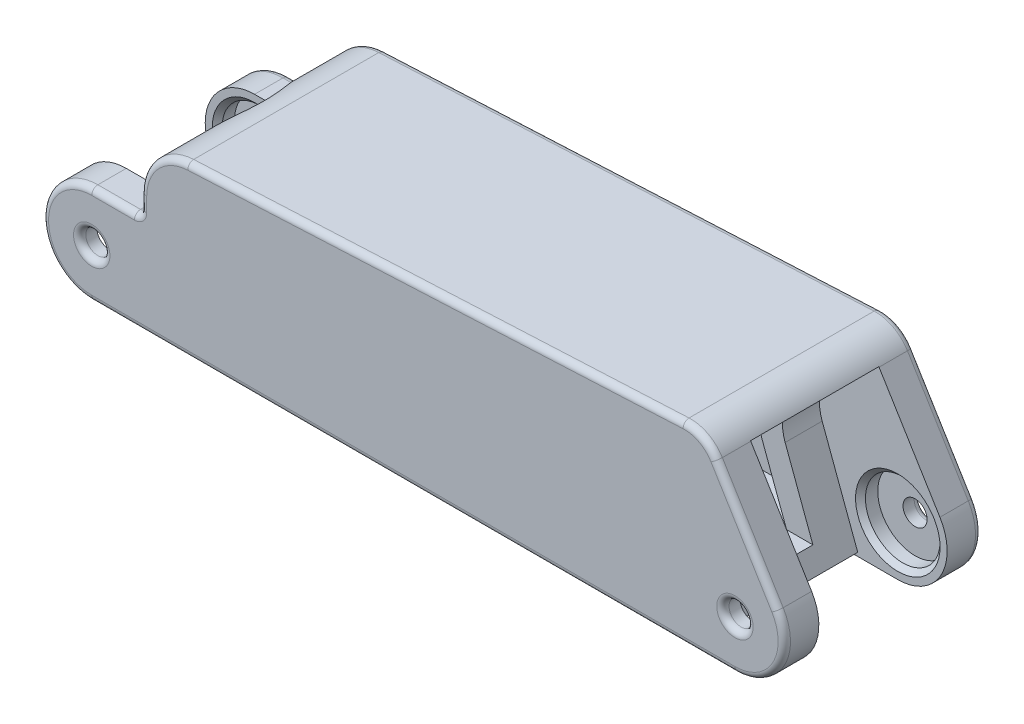
from build123d import *
from OCP.BRepFilletAPI import BRepFilletAPI_MakeChamfer

# Parameters (mm, degrees)
EXTRUDE_1_DEPTH          = 8
EXTRUDE_1_DEPTH_BACK     = 8
CUT_EXTRUDE_1_DEPTH      = 2.2
CUT_EXTRUDE_1_DEPTH_BACK = 2.2
CUT_EXTRUDE_2_DEPTH      = 58.87966418
CUT_EXTRUDE_2_DEPTH_BACK = 58.87966418
SKETCH_3_R               = 0.975
CUT_EXTRUDE_5_DEPTH      = 58.268661587
CUT_EXTRUDE_5_DEPTH_BACK = 58.268661587
CUT_EXTRUDE_6_DEPTH      = 5.2
CUT_EXTRUDE_6_DEPTH_BACK = 5.2
SKETCH_6_R               = 3.025
CUT_EXTRUDE_7_DEPTH      = 1.4
SKETCH_7_R               = 3.025
CUT_EXTRUDE_8_DEPTH      = 1.4
CUT_EXTRUDE_10_DEPTH     = 3.2
SKETCH_8_W               = 15
SKETCH_8_H               = 10.4
CUT_EXTRUDE_9_DEPTH      = 8.4
SKETCH_10_W              = 25
SKETCH_10_H              = 4.4
EXTRUDE_2_DEPTH          = 2
CUT_EXTRUDE_11_DEPTH     = 4.5
FILLET_2_R               = 0.5
CHAMFER_1_SIZE           = 0.4
CHAMFER_1_SIZE2          = 0.311176836
FILLET_3_R               = 1.5


with BuildPart() as part:
    # 草图1 → 凸台-拉伸1 (new, two sides: drawn at the far end of the back side and taken through both)
    with BuildSketch(Plane.XY.offset(-EXTRUDE_1_DEPTH_BACK)):
        with BuildLine():
            Line((0, -4), (52.14, -4))
            ThreePointArc((52.14, -4), (55.62877552, -1.95664135), (55.553141222, 2.085777314))
            Line((55.553141222, 2.085777314), (50.621697444, 10.155533337))
            ThreePointArc((50.621697444, 10.155533337), (49.466230751, 11.242179588), (47.918174328, 11.587758333))
            Line((47.918174328, 11.587758333), (7.766731223, 9.662734546))
            ThreePointArc((7.766731223, 9.662734546), (5.062926971, 8.427194819), (3.958287489, 5.667323904))
            Line((3.958287489, 5.667323904), (3.958287489, 4))
            Line((3.958287489, 4), (0, 4))
            ThreePointArc((0, 4), (-4, 0), (0, -4))
        make_face()
    extrude(amount=EXTRUDE_1_DEPTH + EXTRUDE_1_DEPTH_BACK)

    # 草图2 → 切除-拉伸1 (cut, two sides: drawn at the far end of the back side and taken through both)
    with BuildSketch(Plane.XY.offset(-CUT_EXTRUDE_1_DEPTH_BACK)):
        with BuildLine():
            Line((-1.528760289, -3.696334939), (0.036061068, -6.887575742))
            ThreePointArc((0.036061068, -6.887575742), (2.795380789, -8.566052308), (5.478529806, -6.768320332))
            ThreePointArc((5.478529806, -6.768320332), (6.228661924, -5.326880509), (7.166657167, -4))
            Line((7.166657167, -4), (52.14, -4))
            ThreePointArc((52.14, -4), (55.62877552, -1.95664135), (55.553141222, 2.085777314))
            Line((55.553141222, 2.085777314), (52.700312321, 6.754112641))
            ThreePointArc((52.700312321, 6.754112641), (51.683787236, 8.461058728), (49.823530783, 9.15850702))
            ThreePointArc((49.823530783, 9.15850702), (26.4662767, 8.111764825), (3.449969925, 4))
            Line((3.449969925, 4), (0, 4))
            ThreePointArc((0, 4), (-3.923349319, 0.779313879), (-1.528760289, -3.696334939))
        make_face()
    extrude(amount=CUT_EXTRUDE_1_DEPTH + CUT_EXTRUDE_1_DEPTH_BACK, mode=Mode.SUBTRACT)

    # 草图3 → 切除-拉伸2 (cut, two sides: drawn at the far end of the back side and taken through both)
    with BuildSketch(Plane.XY.offset(-CUT_EXTRUDE_2_DEPTH_BACK)):
        Circle(SKETCH_3_R)
        with Locations((52.14, 0)):
            Circle(SKETCH_3_R)
    extrude(amount=CUT_EXTRUDE_2_DEPTH + CUT_EXTRUDE_2_DEPTH_BACK, mode=Mode.SUBTRACT)

    # 草图4 → 切除-拉伸5 (cut, two sides: drawn at the far end of the back side and taken through both)
    with BuildSketch(Plane(origin=(0, 4, 0), x_dir=(1, 0, 0), z_dir=(0, 1, 0)).offset(-CUT_EXTRUDE_5_DEPTH_BACK)):
        with BuildLine():
            Line((-2.993325909, 5.2), (2.993325909, 5.2))
            ThreePointArc((2.993325909, 5.2), (6, 0), (2.993325909, -5.2))
            Line((2.993325909, -5.2), (-2.993325909, -5.2))
            Line((-2.993325909, -5.2), (-6.83658322, -5.2))
            Line((-6.83658322, -5.2), (-6.83658322, 5.2))
            Line((-6.83658322, 5.2), (-2.993325909, 5.2))
        make_face()
    extrude(amount=CUT_EXTRUDE_5_DEPTH + CUT_EXTRUDE_5_DEPTH_BACK, mode=Mode.SUBTRACT)

    # 草图5 → 切除-拉伸6 (cut, two sides: drawn at the far end of the back side and taken through both)
    with BuildSketch(Plane.XY.offset(-CUT_EXTRUDE_6_DEPTH_BACK)):
        with BuildLine():
            Line((52.14, -4), (49.000491406, -4))
            Line((49.000491406, -4), (46.008602218, 4.062170784))
            ThreePointArc((46.008602218, 4.062170784), (45.982727023, 6.425457247), (47.464884955, 8.26638101))
            Line((47.464884955, 8.26638101), (50.603907824, 10.184644059))
            Line((50.603907824, 10.184644059), (55.553141222, 2.085777314))
            ThreePointArc((55.553141222, 2.085777314), (55.62877552, -1.95664135), (52.14, -4))
        make_face()
    extrude(amount=CUT_EXTRUDE_6_DEPTH + CUT_EXTRUDE_6_DEPTH_BACK, mode=Mode.SUBTRACT)

    # 草图6 → 切除-拉伸7 (cut)
    with BuildSketch(Plane.XY.offset(-5.2)):
        Circle(SKETCH_6_R)
    cut_extrude_7 = extrude(amount=-CUT_EXTRUDE_7_DEPTH, mode=Mode.SUBTRACT)

    # 草图7 → 切除-拉伸8 (cut)
    with BuildSketch(Plane.XY.offset(-5.2)):
        with Locations((52.14, 0)):
            Circle(SKETCH_7_R)
    cut_extrude_8 = extrude(amount=-CUT_EXTRUDE_8_DEPTH, mode=Mode.SUBTRACT)

    # 草图9 → 切除-拉伸10 (cut)
    with BuildSketch(Plane(origin=(0, 0, 2.2), x_dir=(-1, 0, 0), z_dir=(0, 0, -1))):
        with BuildLine():
            Line((-7.582114295, -2), (-7.582114295, 2.921585889))
            ThreePointArc((-7.582114295, 2.921585889), (-25.744504477, 6.016555259), (-44.13144482, 7.187741556))
            ThreePointArc((-44.13144482, 7.187741556), (-43.78994094, 5.276849663), (-44.133551998, 3.366335552))
            Line((-44.133551998, 3.366335552), (-46.125010842, -2))
            Line((-46.125010842, -2), (-7.582114295, -2))
        make_face()
    cut_extrude_10 = extrude(amount=-CUT_EXTRUDE_10_DEPTH, mode=Mode.SUBTRACT)

    # 镜向1: 切除-拉伸7, 切除-拉伸8, 切除-拉伸10 across plane
    add(cut_extrude_7.mirror(Plane.XY), mode=Mode.SUBTRACT)
    add(cut_extrude_8.mirror(Plane.XY), mode=Mode.SUBTRACT)
    add(cut_extrude_10.mirror(Plane.XY), mode=Mode.SUBTRACT)

    # 草图8 → 切除-拉伸9 (cut)
    with BuildSketch(Plane.XZ.offset(4)):
        with Locations((7.5, 0)):
            Rectangle(SKETCH_8_W, SKETCH_8_H)
    extrude(amount=-CUT_EXTRUDE_9_DEPTH, mode=Mode.SUBTRACT)

    # 草图10 → 凸台-拉伸2 (add)
    with BuildSketch(Plane.XZ.offset(4)):
        with Locations((36.500491406, 0)):
            Rectangle(SKETCH_10_W, SKETCH_10_H)
    extrude(amount=-EXTRUDE_2_DEPTH)

    # 草图11 → 切除-拉伸11 (cut)
    with BuildSketch(Plane(origin=(0, 0, -2.2), x_dir=(-1, 0, 0), z_dir=(0, 0, -1))):
        Polygon((-49.000491406, -2), (-49.000491406, -4), (-48.258287037, -2), align=None)
    extrude(amount=-CUT_EXTRUDE_11_DEPTH, mode=Mode.SUBTRACT)

    # 圆角2
    fillet_2_edges = [part.edges().sort_by_distance(p)[0] for p in [
        (26.07, -4, -8),
        (55.62877552, -1.95664135, -8),
        (53.087419333, 6.120655325, -8),
        (49.466230751, 11.242179588, -8),
        (27.842452776, 10.625246439, -8),
        (5.062926971, 8.427194819, -8),
        (3.958287489, 4.833661952, -8),
        (1.979143745, 4, -8),
        (-4, 0, -8),
        (51.165, 0, -8),
        (-0.975, 0, -8),
        (1.979143745, 4, 8),
        (3.958287489, 4.833661952, 8),
        (5.062926971, 8.427194819, 8),
        (27.842452776, 10.625246439, 8),
        (49.466230751, 11.242179588, 8),
        (53.087419333, 6.120655325, 8),
        (55.62877552, -1.95664135, 8),
        (26.07, -4, 8),
        (-4, 0, 8),
        (51.165, 0, 8),
        (-0.975, 0, 8),
        (3.958287489, 4, 6.6),
        (3.958287489, 4, -6.6),
    ]]
    fillet(fillet_2_edges, radius=FILLET_2_R)

    # 倒角1: one chamfer whose edges measure the first distance from different faces: ONE call of the kernel's chamfer builder (chamfer() names one face for all edges)
    chamfer_1_edges_1 = [part.edges().sort_by_distance(p)[0] for p in [
        (49.000491406, -4, 0),
    ]]
    chamfer_1_side_1 = [part.faces().sort_by_distance(p)[0] for p in [
        (30.325944119, -4, 0),
    ]]
    chamfer_1_edges_2 = [part.edges().sort_by_distance(p)[0] for p in [
        (-3.025, 0, -5.2),
        (49.115, 0, -5.2),
        (-3.025, 0, 5.2),
        (49.115, 0, 5.2),
    ]]
    chamfer_1 = BRepFilletAPI_MakeChamfer(part.part.solid().wrapped)
    for e in chamfer_1_edges_1:
        chamfer_1.Add(CHAMFER_1_SIZE, CHAMFER_1_SIZE2, e.wrapped, chamfer_1_side_1[0].wrapped)  # the first distance lies on this face
    for e in chamfer_1_edges_2:
        chamfer_1.Add(CHAMFER_1_SIZE, e.wrapped)
    add(Compound.cast(chamfer_1.Shape()), mode=Mode.REPLACE)

    # 圆角3
    fillet_3_edges = [part.edges().sort_by_distance(p)[0] for p in [
        (15, -3, -5.2),
        (24.000491406, -3, -2.2),
        (24.000491406, -3, 2.2),
        (15, -3, 5.2),
        (15, -3, -2.2),
        (15, -3, 2.2),
    ]]
    fillet(fillet_3_edges, radius=FILLET_3_R - 0.0001)  # a hair under: the kernel refuses the full size


solid = part.part
